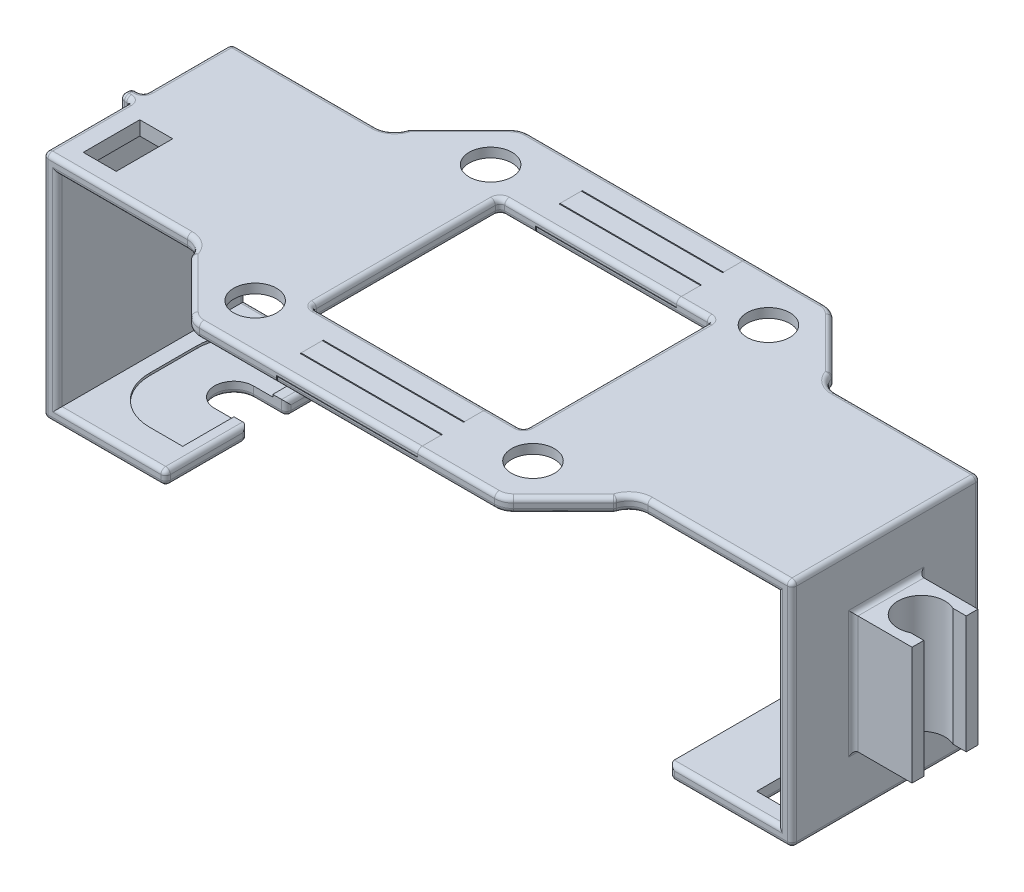
from build123d import *

# Parameters (mm, degrees)
BOSS_EXTRUDE1_DEPTH    = 3
BOSS_EXTRUDE2_DEPTH    = 40
CUT_EXTRUDE1_REACH     = 101.731
CUT_EXTRUDE3_REACH     = 101.731
SKETCH7_W              = 7
SKETCH7_H              = 12
CUT_EXTRUDE5_REACH     = 101.731
SKETCH8_W              = 7
SKETCH8_H              = 12
RIB3_W                 = 2.5
RIB3_H                 = 49
BOSS_EXTRUDE6_DEPTH    = 2.5
SKETCH12_W             = 17
SKETCH12_H             = 30
CUT_EXTRUDE9_DEPTH     = 0.5
FILLET10_R             = 10
RIB1_W                 = 14
RIB1_H                 = 25
BOSS_EXTRUDE7_DEPTH    = 12.5
CUT_EXTRUDE10_DEPTH    = 106.157025443
CHAMFER1_SIZE          = 12
FILLET14_R             = 4
SPLIT3_SURFACE_1_BACK  = 194.848
SPLIT3_SURFACE_1_DEPTH = 389.696
SPLIT3_SURFACE_2_BACK  = 194.848
SPLIT3_SURFACE_2_DEPTH = 389.696
SKETCH33_W             = 30
SKETCH33_H             = 0.4
CUT_EXTRUDE18_DEPTH    = 125.41864812
SKETCH34_R             = 4.55
SKETCH34_W             = 45
SKETCH34_H             = 40
CUT_EXTRUDE19_DEPTH    = 10
SKETCH38_W             = 30
SKETCH38_H             = 5.25
CUT_EXTRUDE23_DEPTH    = 1.5
SKETCH39_W             = 30
SKETCH39_H             = 5.05
BOSS_EXTRUDE8_DEPTH    = 1.5
SKETCH41_W             = 29.8
SKETCH41_H             = 5.05
BOSS_EXTRUDE9_DEPTH    = 1.4
BOSS_EXTRUDE9_2_DEPTH  = 1.4
SKETCH43_W             = 29.8
SKETCH43_H             = 5.05
BOSS_EXTRUDE10_DEPTH   = 1.4
BOSS_EXTRUDE10_2_DEPTH = 1.4
SKETCH44_W             = 30
SKETCH44_H             = 5.25
CUT_EXTRUDE24_DEPTH    = 1.4
SKETCH46_R             = 6.5
CUT_EXTRUDE25_DEPTH    = 1
FILLET18_R             = 1
FILLET19_R             = 1


with BuildPart() as part:
    # Sketch2 → Boss-Extrude1 (new body)
    with BuildSketch(Plane(origin=(0, 0, 0), x_dir=(1, 0, 0), z_dir=(0, 1, 0))):
        Polygon((45, -20), (52.5, -20), (76.5, -20), (79.5, -20), (79.5, 20), (76.5, 20), (52.5, 20), (45, 20), (45, 35), (-45, 35), (-45, 20), (-52.5, 20), (-76.5, 20), (-79.5, 20), (-79.5, -20), (-76.5, -20), (-52.5, -20), (-45, -20), (-45, -35), (45, -35), align=None)
    extrude(amount=BOSS_EXTRUDE1_DEPTH)

    # Sketch4 → Boss-Extrude2 (add)
    with BuildSketch(Plane(origin=(0, 0, -20), x_dir=(-1, 0, 0), z_dir=(0, 0, -1))):
        Polygon((79.5, 0), (79.5, -46), (53.5, -46), (53.5, -43), (76.5, -43), (76.5, 0), align=None)
    boss_extrude2 = extrude(amount=-BOSS_EXTRUDE2_DEPTH)

    # Mirror1: Boss-Extrude2 across plane
    add(boss_extrude2.mirror(Plane(origin=(0, 0, 0), x_dir=(0, 0, 1), z_dir=(1, 0, 0))))

    # Sketch5 → Cut-Extrude1 (cut, up to next)
    with BuildSketch(Plane.XZ.offset(46), mode=Mode.PRIVATE) as cut_extrude1_sk1:
        with BuildLine():
            Line((-53.5, 2.625), (-60.5, 2.625))
            ThreePointArc((-60.5, 2.625), (-64.625, -1.5), (-60.5, -5.625))
            Line((-60.5, -5.625), (-53.5, -5.625))
            Line((-53.5, -5.625), (-53.5, 2.625))
        make_face()
    cut_extrude1_tool1 = extrude(cut_extrude1_sk1.sketch, amount=-CUT_EXTRUDE1_REACH, mode=Mode.PRIVATE) & part.part
    add(cut_extrude1_tool1.solids().sort_by_distance((-58.661274, -46, -1.5))[0], mode=Mode.SUBTRACT)

    # Sketch7 → Cut-Extrude3 (cut, up to next)
    with BuildSketch(Plane.XZ.offset(46), mode=Mode.PRIVATE) as cut_extrude3_sk1:
        with Locations((71.5, 10)):
            Rectangle(SKETCH7_W, SKETCH7_H)
    cut_extrude3_tool1 = extrude(cut_extrude3_sk1.sketch, amount=-CUT_EXTRUDE3_REACH, mode=Mode.PRIVATE) & part.part
    add(cut_extrude3_tool1.solids().sort_by_distance((71.5, -46, 10))[0], mode=Mode.SUBTRACT)

    # Sketch8 → Cut-Extrude5 (cut, up to next)
    with BuildSketch(Plane(origin=(0, 3, 0), x_dir=(1, 0, 0), z_dir=(0, 1, 0)), mode=Mode.PRIVATE) as cut_extrude5_sk1:
        with Locations((-71.5, -10)):
            Rectangle(SKETCH8_W, SKETCH8_H)
    cut_extrude5_tool1 = extrude(cut_extrude5_sk1.sketch, amount=-CUT_EXTRUDE5_REACH, mode=Mode.PRIVATE) & part.part
    add(cut_extrude5_tool1.solids().sort_by_distance((-71.5, 3, 10))[0], mode=Mode.SUBTRACT)

    # Rib3 → Boss-Extrude6 (add)
    with BuildSketch(Plane.ZY.offset(79.5)):
        with Locations((0, -21.5)):
            Rectangle(RIB3_W, RIB3_H)
    extrude(amount=BOSS_EXTRUDE6_DEPTH)

    # Sketch12 → Cut-Extrude9 (cut)
    with BuildSketch(Plane(origin=(0, -43, 0), x_dir=(1, 0, 0), z_dir=(0, 1, 0))):
        with Locations((-64.875, 1.5)):
            Rectangle(SKETCH12_W, SKETCH12_H)
    extrude(amount=-CUT_EXTRUDE9_DEPTH, mode=Mode.SUBTRACT)

    # Fillet10
    fillet10_edges = [part.edges().sort_by_distance(p)[0] for p in [
        (-73.375, -43.25, 13.5),
        (-73.375, -43.25, -16.5),
    ]]
    fillet(fillet10_edges, radius=FILLET10_R)

    # rib1 → Boss-Extrude7 (add)
    with BuildSketch(Plane(origin=(79.5, 0, 0), x_dir=(0, 0, -1), z_dir=(1, 0, 0))):
        with Locations((0, -21.5)):
            Rectangle(RIB1_W, RIB1_H)
    extrude(amount=BOSS_EXTRUDE7_DEPTH)

    # Sketch13 → Cut-Extrude10 (cut, through all)
    with BuildSketch(Plane.XZ.offset(34)):
        with BuildLine():
            Line((92, -4.5), (92, 4.5))
            Line((92, 4.5), (89.179449472, 4.5))
            ThreePointArc((89.179449472, 4.5), (82, 0), (89.179449472, -4.5))
            Line((89.179449472, -4.5), (92, -4.5))
        make_face()
    extrude(amount=-CUT_EXTRUDE10_DEPTH, mode=Mode.SUBTRACT)

    # Chamfer1
    chamfer1_edges = [part.edges().sort_by_distance(p)[0] for p in [
        (-45, 1.5, -35),
        (45, 1.5, -35),
        (45, 1.5, 35),
        (-45, 1.5, 35),
    ]]
    chamfer(chamfer1_edges, length=CHAMFER1_SIZE)

    # Fillet14
    # the kernel refuses this fillet: 4 mm, written as the material it adds along each edge
    with BuildSketch(Plane(origin=(-45, 0, 20), x_dir=(0, 0, 1), z_dir=(0, 1, 0)), Plane(origin=(45, 0, -20), x_dir=(0, 0, -1), z_dir=(0, 1, 0))) as fillet14_piece_1:
        with BuildLine():
            CenterArc((4, -3.872983346), FILLET14_R, 104.477512186, 75.522487814)
            Line((0, -3.872983346), (0, 0))
            Line((0, 0), (3, 0))
        make_face()
    extrude(amount=3)
    with BuildSketch(Plane(origin=(45, 0, 20), x_dir=(1, 0, 0), z_dir=(0, 1, 0))) as fillet14_piece_2:
        with BuildLine():
            CenterArc((3.872983346, -4), FILLET14_R, 90, 75.522487814)
            Line((0, -3), (0, 0))
            Line((0, 0), (3.872983346, 0))
        make_face()
    extrude(amount=3)
    with BuildSketch(Plane(origin=(-45, 0, -20), x_dir=(0, 0, -1), z_dir=(0, 1, 0))) as fillet14_piece_3:
        with BuildLine():
            CenterArc((4, 3.872983346), FILLET14_R, 180, 75.522487814)
            Line((0, 3.872983346), (0, 0))
            Line((0, 0), (3, 0))
        make_face()
    extrude(amount=3)
    # the kernel refuses this fillet: 4 mm, written as the material it takes off along each edge
    with BuildSketch(Plane(origin=(-33, -4.142135624, 35), x_dir=(1, 0, 0), z_dir=(0, 1, 0)), Plane(origin=(33, -4.142135624, 35), x_dir=(0.7071067811865475, 0, -0.7071067811865475), z_dir=(0, 1, 0))) as fillet14_2_piece_1:
        with BuildLine():
            CenterArc((FILLET14_R * 0.414213562373, FILLET14_R), FILLET14_R, 225, 45)
            Line((-FILLET14_R * 0.292893218813, FILLET14_R * 0.292893218813), (0, 0))
            Line((0, 0), (FILLET14_R * 0.414213562373, 0))
        make_face()
    extrude(amount=11.284271247, mode=Mode.SUBTRACT)
    with BuildSketch(Plane(origin=(-33, -4.142135624, -35), x_dir=(1, 0, 0), z_dir=(0, 1, 0)), Plane(origin=(33, -4.142135624, -35), x_dir=(0.7071067811865475, 0, 0.7071067811865475), z_dir=(0, 1, 0))) as fillet14_2_piece_2:
        with BuildLine():
            CenterArc((FILLET14_R * 0.414213562373, -FILLET14_R), FILLET14_R, 90, 45)
            Line((-FILLET14_R * 0.292893218813, -FILLET14_R * 0.292893218813), (0, 0))
            Line((0, 0), (FILLET14_R * 0.414213562373, 0))
        make_face()
    extrude(amount=11.284271247, mode=Mode.SUBTRACT)


with BuildPart() as body_2:
    # Split3: the piece behind the surface
    add(part.part)
    # Split3 surface: a surface, the sketch's curves swept straight by 389.696 mm
    with BuildLine(Plane(origin=(0, 0, -35), x_dir=(-1, 0, 0), z_dir=(0, 0, -1)).offset(-SPLIT3_SURFACE_1_BACK), mode=Mode.PRIVATE) as split3_surface_1_path:
        Line((15, 10.5), (15, 1.5))
        Line((15, 1.5), (-15, 1.5))
        Line((-15, 1.5), (-15, -4.5))
    split3_surface_1 = Shell.extrude(split3_surface_1_path.wire(), (0 * SPLIT3_SURFACE_1_DEPTH, 0 * SPLIT3_SURFACE_1_DEPTH, -1 * SPLIT3_SURFACE_1_DEPTH))
    split(bisect_by=split3_surface_1, keep=Keep.BOTTOM)


with BuildPart() as part_1:
    add(part.part)

    # Split3: split by a surface, the side it looks to stays
    # Split3 surface: a surface, the sketch's curves swept straight by 389.696 mm
    with BuildLine(Plane(origin=(0, 0, -35), x_dir=(-1, 0, 0), z_dir=(0, 0, -1)).offset(-SPLIT3_SURFACE_2_BACK), mode=Mode.PRIVATE) as split3_surface_2_path:
        Line((15, 10.5), (15, 1.5))
        Line((15, 1.5), (-15, 1.5))
        Line((-15, 1.5), (-15, -4.5))
    split3_surface_2 = Shell.extrude(split3_surface_2_path.wire(), (0 * SPLIT3_SURFACE_2_DEPTH, 0 * SPLIT3_SURFACE_2_DEPTH, -1 * SPLIT3_SURFACE_2_DEPTH))
    split(bisect_by=split3_surface_2, keep=Keep.TOP)


with BuildPart() as cut_extrude18_tool:
    # Sketch33 → Cut-Extrude18 (new, through all)
    with BuildSketch(Plane(origin=(0, 0, -35), x_dir=(-1, 0, 0), z_dir=(0, 0, -1))):
        with Locations((0, 1.5)):
            Rectangle(SKETCH33_W, SKETCH33_H)
    extrude(amount=-CUT_EXTRUDE18_DEPTH)


with BuildPart() as part_2:
    add(part_1.part)

    # Cut-Extrude18: cut by cut_extrude18_tool
    add(cut_extrude18_tool.part, mode=Mode.SUBTRACT)


with BuildPart() as body_2_1:
    add(body_2.part)

    # Cut-Extrude18: cut by cut_extrude18_tool
    add(cut_extrude18_tool.part, mode=Mode.SUBTRACT)


with BuildPart() as cut_extrude19_tool:
    # Sketch34 → Cut-Extrude19 (new body)
    with BuildSketch(Plane.XZ):
        with Locations(Location((-29.5, 25, 0), (0, 0, 270))):
            Circle(SKETCH34_R)
        with Locations(Location((29.5, 25, 0), (0, 0, 270))):
            Circle(SKETCH34_R)
        with Locations(Location((29.5, -25, 0), (0, 0, 270))):
            Circle(SKETCH34_R)
        with Locations(Location((-29.5, -25, 0), (0, 0, 270))):
            Circle(SKETCH34_R)
        Rectangle(SKETCH34_W, SKETCH34_H)
    extrude(amount=-CUT_EXTRUDE19_DEPTH)


with BuildPart() as part_3:
    add(part_2.part)

    # Cut-Extrude19: cut by cut_extrude19_tool
    add(cut_extrude19_tool.part, mode=Mode.SUBTRACT)

    # Sketch38 → Cut-Extrude23 (cut)
    with BuildSketch(Plane.XZ):
        with Locations((0, -32.375)):
            Rectangle(SKETCH38_W, SKETCH38_H)
        with Locations((0, -22.625)):
            Rectangle(SKETCH38_W, SKETCH38_H)
    cut_extrude23 = extrude(amount=-CUT_EXTRUDE23_DEPTH, mode=Mode.SUBTRACT)

    # Sketch39 → Boss-Extrude8 (add)
    with BuildSketch(Plane(origin=(0, 3, 0), x_dir=(1, 0, 0), z_dir=(0, 1, 0))):
        with Locations((0, 32.475)):
            Rectangle(SKETCH39_W, SKETCH39_H)
        with Locations((0, 22.525)):
            Rectangle(SKETCH39_W, SKETCH39_H)
    boss_extrude8 = extrude(amount=-BOSS_EXTRUDE8_DEPTH)

    # Mirror2: Cut-Extrude23 across plane
    add(cut_extrude23.mirror(Plane.XY), mode=Mode.SUBTRACT)

    # Mirror2 2: Boss-Extrude8 across plane
    add(boss_extrude8.mirror(Plane.XY))


with BuildPart() as body_2_2:
    add(body_2_1.part)

    # Cut-Extrude19: cut by cut_extrude19_tool
    add(cut_extrude19_tool.part, mode=Mode.SUBTRACT)


with BuildPart() as body_3:
    # Sketch41 → Boss-Extrude9 (new body)
    with BuildSketch(Plane.XZ):
        with Locations((0.1, -22.525)):
            Rectangle(SKETCH41_W, SKETCH41_H)
    extrude(amount=-BOSS_EXTRUDE9_DEPTH)


with BuildPart() as body_4:
    # Sketch41 → Boss-Extrude9 2 (new body)
    with BuildSketch(Plane.XZ):
        with Locations((0.1, -32.475)):
            Rectangle(SKETCH41_W, SKETCH41_H)
    extrude(amount=-BOSS_EXTRUDE9_2_DEPTH)


with BuildPart() as body_5:
    # Sketch43 → Boss-Extrude10 (new body)
    with BuildSketch(Plane.XZ):
        with Locations((0.1, 32.475)):
            Rectangle(SKETCH43_W, SKETCH43_H)
    extrude(amount=-BOSS_EXTRUDE10_DEPTH)


with BuildPart() as body_6:
    # Sketch43 → Boss-Extrude10 2 (new body)
    with BuildSketch(Plane.XZ):
        with Locations((0.1, 22.525)):
            Rectangle(SKETCH43_W, SKETCH43_H)
    extrude(amount=-BOSS_EXTRUDE10_2_DEPTH)

    # Combine7: union body 5, body 4, body 3, body 2
    add(body_5.part)
    add(body_4.part)
    add(body_3.part)
    add(body_2_2.part)

    # Sketch44 → Cut-Extrude24 (cut)
    with BuildSketch(Plane(origin=(0, 3, 0), x_dir=(1, 0, 0), z_dir=(0, 1, 0))):
        with Locations((0, -22.625)):
            Rectangle(SKETCH44_W, SKETCH44_H)
        Polygon((0, -35), (-15, -35), (-15, -29.75), (15, -29.75), (15, -35), align=None)
    cut_extrude24 = extrude(amount=-CUT_EXTRUDE24_DEPTH, mode=Mode.SUBTRACT)

    # Mirror4: Cut-Extrude24 across plane
    add(cut_extrude24.mirror(Plane.XY), mode=Mode.SUBTRACT)


with BuildPart() as cut_extrude25_tool:
    # Sketch46 → Cut-Extrude25 (new body)
    with BuildSketch(Plane.XZ):
        with Locations(Location((-29.5, 25, 0), (0, 0, 270))):
            Circle(SKETCH46_R)
        with Locations(Location((29.5, 25, 0), (0, 0, 270))):
            Circle(SKETCH46_R)
        with Locations(Location((29.5, -25, 0), (0, 0, 270))):
            Circle(SKETCH46_R)
        with Locations(Location((-29.5, -25, 0), (0, 0, 270))):
            Circle(SKETCH46_R)
    extrude(amount=-CUT_EXTRUDE25_DEPTH)


with BuildPart() as part_4:
    add(part_3.part)

    # Cut-Extrude25: cut by cut_extrude25_tool
    add(cut_extrude25_tool.part, mode=Mode.SUBTRACT)

    # Fillet18
    fillet18_edges = [part_4.edges().sort_by_distance(p)[0] for p in [
        (-53.5, -46, 11.3125),
        (-53.5, -44.5, 2.625),
        (-53.5, -44.5, 20),
        (-53.5, -44.5, -5.625),
        (-53.5, -44.5, -20),
        (-53.5, -43, 11.3125),
        (-53.5, -43, -12.8125),
        (-53.5, -46, -12.8125),
        (-46.423493603, 0, -20.83772234),
        (-46.423493603, 3, -20.83772234),
        (-79.5, -21.5, -20),
        (-66.5, -46, 20),
        (-66.5, -46, -20),
        (-65, -43, -20),
        (-65, -43, 20),
        (-76.5, -21.5, 20),
        (-76.5, -21.5, -20),
        (-62.686491673, 0, -20),
        (-64.186491673, 3, -20),
        (-64.625, -46, -1.5),
        (-57, -46, -5.625),
        (-79.5, -46, -10.625),
        (-80.75, -46, -1.25),
        (-82, -46, 0),
        (-80.75, -46, 1.25),
        (-79.5, -46, 10.625),
        (-57, -46, 2.625),
        (-80.75, 3, -1.25),
        (-80.75, 3, 1.25),
        (-79.5, 3, -10.625),
        (-79.5, -21.5, -1.25),
        (-79.5, 3, 10.625),
        (-79.5, -21.5, 20),
        (-79.5, -21.5, 1.25),
        (-8.171572875, 3, 35),
        (-32.87387948, 3, 34.69551813),
        (-39.585786438, 3, 28.414213562),
        (-46.423493603, 3, 20.83772234),
        (-64.186491673, 3, 20),
        (-39.585786438, 3, -28.414213562),
        (-32.87387948, 3, -34.69551813),
        (-8.171572875, 3, -35),
        (-22.5, 3, 0),
        (-82, -21.5, -1.25),
        (-82, 3, 0),
        (-82, -21.5, 1.25),
        (-46.423493603, 0, 20.83772234),
        (-62.686491673, 0, 20),
        (-23.171572875, 0, -35),
        (-32.87387948, 0, -34.69551813),
        (-45, 1.5, -23),
        (-39.585786438, 0, -28.414213562),
        (-23.171572875, 0, 35),
        (-32.87387948, 0, 34.69551813),
        (-45, 1.5, 23),
        (-39.585786438, 0, 28.414213562),
        (-18.75, 0, -20),
        (-18.75, 0, 20),
        (-22.5, 1.5, -20),
        (-22.5, 0, 0),
        (-22.5, 1.5, 20),
        (-3.75, 3, 20),
        (-3.75, 3, -20),
    ]]
    fillet(fillet18_edges, radius=FILLET18_R)


with BuildPart() as body_6_1:
    add(body_6.part)

    # Cut-Extrude25: cut by cut_extrude25_tool
    add(cut_extrude25_tool.part, mode=Mode.SUBTRACT)

    # Fillet19
    fillet19_edges = [body_6_1.edges().sort_by_distance(p)[0] for p in [
        (18.75, 3, -20),
        (3.85, 0, -20),
        (8.271572875, 0, -35),
        (32.87387948, 0, -34.69551813),
        (39.585786438, 0, -28.414213562),
        (46.423493603, 0, -20.83772234),
        (46.423493603, 0, 20.83772234),
        (39.585786438, 0, 28.414213562),
        (32.87387948, 0, 34.69551813),
        (8.271572875, 0, 35),
        (71.5, -46, 4),
        (68, -46, 10),
        (71.5, -46, 16),
        (75, -46, 10),
        (79.5, -34, 0),
        (79.5, -21.5, -7),
        (79.5, -9, 0),
        (79.5, -21.5, 7),
        (66.5, -46, 20),
        (53.5, -46, 0),
        (66.5, -46, -20),
        (53.5, -44.5, 20),
        (53.5, -44.5, -20),
        (65, -43, 20),
        (65, -43, -20),
        (76.5, -21.5, 20),
        (76.5, -21.5, -20),
        (45, 1.5, -23),
        (62.686491673, 0, -20),
        (79.5, -21.5, -20),
        (79.5, -21.5, 20),
        (79.5, -46, 0),
        (62.686491673, 0, 20),
        (45, 1.5, 23),
        (22.5, 3, 0),
        (18.75, 3, 20),
        (32.87387948, 3, 34.69551813),
        (39.585786438, 3, 28.414213562),
        (46.423493603, 3, 20.83772234),
        (64.186491673, 3, 20),
        (79.5, 3, 0),
        (64.186491673, 3, -20),
        (46.423493603, 3, -20.83772234),
        (39.585786438, 3, -28.414213562),
        (32.87387948, 3, -34.69551813),
        (23.171572875, 3, -35),
        (22.5, 1.5, -20),
        (22.5, 0, 0),
        (22.5, 1.5, 20),
        (3.85, 0, 20),
        (23.171572875, 3, 35),
    ]]
    fillet(fillet19_edges, radius=FILLET19_R)


solid = Compound([part_4.part, body_6_1.part])
